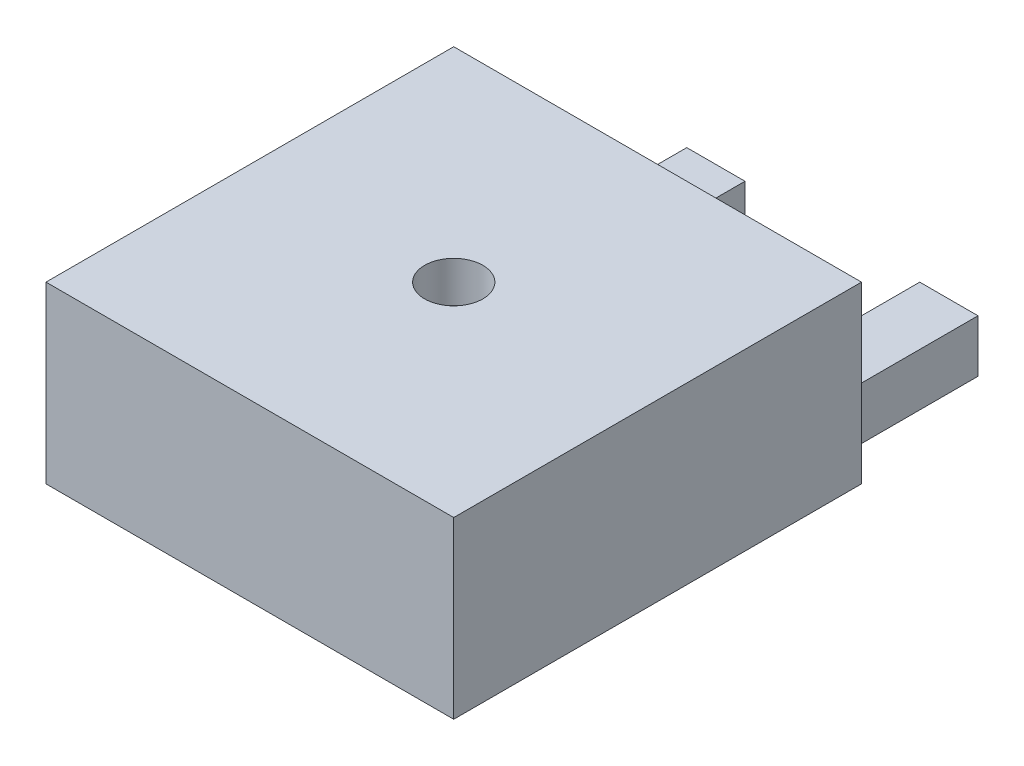
from build123d import *

# Parameters (mm, degrees)
ESQUISSE1_W              = 70
ESQUISSE1_H              = 70
BOSS_EXTRU_4_DEPTH       = 30
ESQUISSE5_W              = 60
ESQUISSE5_H              = 60
ENL_V_MAT_EXTRU_3_DEPTH  = 23
ESQUISSE6_R              = 5
ENL_V_MAT_EXTRU_4_DEPTH  = 23
ESQUISSE28_W             = 10
ESQUISSE28_H             = 30
BOSS_EXTRU_8_DEPTH       = 5
BOSS_EXTRU_9_DEPTH       = 10
ESQUISSE30_W             = 10
ESQUISSE30_H             = 30
BOSS_EXTRU_10_DEPTH      = 5
BOSS_EXTRU_14_DEPTH      = 10
ENL_V_MAT_EXTRU_6_DEPTH  = 10
ENL_V_MAT_EXTRU_15_DEPTH = 14
ENL_V_MAT_EXTRU_16_DEPTH = 10
ENL_V_MAT_EXTRU_17_DEPTH = 10
ENL_V_MAT_EXTRU_18_DEPTH = 10
ENL_V_MAT_EXTRU_19_DEPTH = 10
ENL_V_MAT_EXTRU_20_DEPTH = 10
ESQUISSE51_W             = 10
ESQUISSE51_H             = 1
ENL_V_MAT_EXTRU_21_DEPTH = 37


with BuildPart() as part:
    # Esquisse1 → Boss.-Extru.4 (new body)
    with BuildSketch(Plane(origin=(0, 0, 0), x_dir=(1, 0, 0), z_dir=(0, 1, 0))):
        with Locations((35, 35)):
            Rectangle(ESQUISSE1_W, ESQUISSE1_H)
    extrude(amount=BOSS_EXTRU_4_DEPTH)

    # Esquisse5 → Enlèv. mat.-Extru.3 (cut)
    with BuildSketch(Plane(origin=(0, 0, 0), x_dir=(-1, 0, 0), z_dir=(0, -1, 0))):
        with Locations((-35, 35)):
            Rectangle(ESQUISSE5_W, ESQUISSE5_H)
    extrude(amount=-ENL_V_MAT_EXTRU_3_DEPTH, mode=Mode.SUBTRACT)

    # Esquisse6 → Enlèv. mat.-Extru.4 (cut)
    with BuildSketch(Plane(origin=(0, 23, 0), x_dir=(-1, 0, 0), z_dir=(0, -1, 0))):
        with Locations((-35, 35)):
            Circle(ESQUISSE6_R)
    extrude(amount=-ENL_V_MAT_EXTRU_4_DEPTH, mode=Mode.SUBTRACT)

    # Esquisse28 → Boss.-Extru.8 (add, symmetric)
    with BuildSketch(Plane.XZ):
        with Locations((55.004966989, -85)):
            Rectangle(ESQUISSE28_W, ESQUISSE28_H)
    extrude(amount=BOSS_EXTRU_8_DEPTH, both=True)

    # Esquisse29 → Boss.-Extru.9 (add)
    with BuildSketch(Plane(origin=(60.004966989, 0, 0), x_dir=(0, 0, -1), z_dir=(1, 0, 0))):
        Polygon((98.219627618, -9.8354956), (100, -5), (85, -5), (97.329441427, -12.2532434), align=None)
    extrude(amount=-BOSS_EXTRU_9_DEPTH)

    # Esquisse30 → Boss.-Extru.10 (add, symmetric)
    with BuildSketch(Plane.XZ):
        with Locations((15.004966989, -85)):
            Rectangle(ESQUISSE30_W, ESQUISSE30_H)
    extrude(amount=BOSS_EXTRU_10_DEPTH, both=True)

    # Esquisse39 → Boss.-Extru.14 (add)
    with BuildSketch(Plane.ZY.offset(-10.004966989)):
        Polygon((-100, -5), (-95.960946885, -15.231620103), (-85, -5), align=None)
    extrude(amount=-BOSS_EXTRU_14_DEPTH)

    # Esquisse40 → Enlèv. mat.-Extru.6 (cut)
    with BuildSketch(Plane(origin=(0, -34.827896321, -88.22508495), x_dir=(-1, 0, 0), z_dir=(0, -0.3671866467775486, -0.930147282116257))):
        Polygon((-20.004966989, 21.067928267), (-20.004966989, 22.067928267), (-10.004966989, 21.067928267), align=None)
    extrude(amount=-ENL_V_MAT_EXTRU_6_DEPTH, mode=Mode.SUBTRACT)

    # Esquisse41 → Enlèv. mat.-Extru.15 (cut)
    with BuildSketch(Plane(origin=(0, -33.020314107, -89.683251213), x_dir=(-1, 0, 0), z_dir=(0, -0.34551294756569506, -0.9384139827733097))):
        Polygon((-60.004966989, 23.129967252), (-60.004966989, 22.129967252), (-50.004966989, 22.129967252), align=None)
    extrude(amount=-ENL_V_MAT_EXTRU_15_DEPTH, mode=Mode.SUBTRACT)

    # Esquisse43 → Enlèv. mat.-Extru.16 (cut)
    with BuildSketch(Plane(origin=(0, -33.020314107, -89.683251213), x_dir=(-1, 0, 0), z_dir=(0, -0.345512947565695, -0.9384139827733096))):
        Polygon((-50.004966989, 22.129967252), (-50.004966989, 23.329813083), (-60.004966989, 24.447460133), (-60.004966989, 23.129967252), align=None)
    extrude(amount=-ENL_V_MAT_EXTRU_16_DEPTH, mode=Mode.SUBTRACT)

    # Esquisse44 → Enlèv. mat.-Extru.17 (cut)
    with BuildSketch(Plane.ZY.offset(-50.004966989)):
        Polygon((-70, -5), (-70, -4.002738473), (-84.995855928, -4.002738473), (-97.744003697, -11.127291295), (-91.520267767, -8.835785216), (-85, -5), align=None)
    extrude(amount=-ENL_V_MAT_EXTRU_17_DEPTH, mode=Mode.SUBTRACT)

    # Esquisse45 → Enlèv. mat.-Extru.18 (cut)
    with BuildSketch(Plane(origin=(0, -34.827896321, -88.22508495), x_dir=(-1, 0, 0), z_dir=(0, -0.3671866467775486, -0.930147282116257))):
        Polygon((-20.004966989, 22.067928267), (-20.004966989, 22.185575327), (-10.004966989, 21.067928267), align=None)
    extrude(amount=-ENL_V_MAT_EXTRU_18_DEPTH, mode=Mode.SUBTRACT)

    # Esquisse47 → Enlèv. mat.-Extru.19 (cut)
    with BuildSketch(Plane.ZY.offset(-10.004966989)):
        Polygon((-85, -5), (-95.960946885, -15.231620103), (-100, -5), align=None)
    extrude(amount=-ENL_V_MAT_EXTRU_19_DEPTH, mode=Mode.SUBTRACT)

    # Esquisse49 → Enlèv. mat.-Extru.20 (cut)
    with BuildSketch(Plane.ZY.offset(-50.004966989)):
        Polygon((-84.995855928, -4.002738473), (-100, -4.002738473), (-100, -5), (-97.744003697, -11.127291295), align=None)
    extrude(amount=-ENL_V_MAT_EXTRU_20_DEPTH, mode=Mode.SUBTRACT)

    # Esquisse51 → Enlèv. mat.-Extru.21 (cut)
    with BuildSketch(Plane(origin=(0, 0, -100), x_dir=(-1, 0, 0), z_dir=(0, 0, -1))):
        with Locations((-15.004966989, -4.5)):
            Rectangle(ESQUISSE51_W, ESQUISSE51_H)
    extrude(amount=-ENL_V_MAT_EXTRU_21_DEPTH, mode=Mode.SUBTRACT)


solid = part.part
